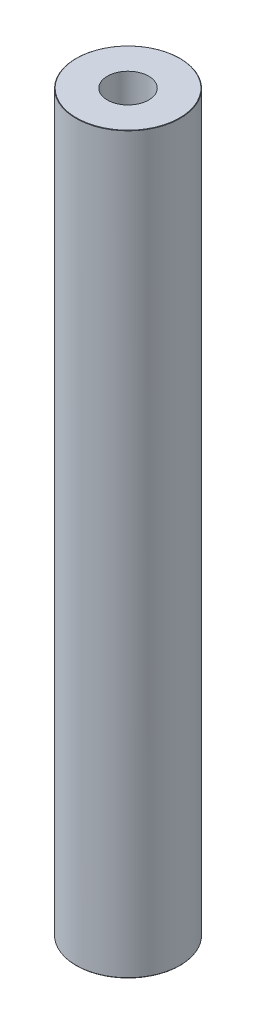
from build123d import *
from OCP.BRepFilletAPI import BRepFilletAPI_MakeChamfer

# Parameters (mm, degrees)
SKETCH1_R           = 42.5
BOSS_EXTRUDE1_DEPTH = 600
SKETCH2_R           = 16.905892699
CUT_EXTRUDE1_DEPTH  = 604.002902149
CHAMFER1_SIZE       = 0.224247194
CHAMFER1_SIZE2      = 0.339037478


with BuildPart() as part:
    # Sketch1 → Boss-Extrude1 (new body)
    with BuildSketch(Plane(origin=(0, 0, 0), x_dir=(1, 0, 0), z_dir=(0, 1, 0))):
        Circle(SKETCH1_R)
    extrude(amount=BOSS_EXTRUDE1_DEPTH)

    # Sketch2 → Cut-Extrude1 (cut, through all)
    with BuildSketch(Plane(origin=(0, 0, 0), x_dir=(1, 0, 0), z_dir=(0, 1, 0))):
        Circle(SKETCH2_R)
    extrude(amount=CUT_EXTRUDE1_DEPTH, mode=Mode.SUBTRACT)

    # Chamfer1: one chamfer whose edges measure the first distance from different faces: ONE call of the kernel's chamfer builder (chamfer() names one face for all edges)
    chamfer1_edges_1 = [part.edges().sort_by_distance(p)[0] for p in [
        (-42.5, 600, 0),
    ]]
    chamfer1_side_1 = [part.faces().sort_by_distance(p)[0] for p in [
        (-42.5, 300, 0),
    ]]
    chamfer1_edges_2 = [part.edges().sort_by_distance(p)[0] for p in [
        (-42.5, 0, 0),
    ]]
    chamfer1_side_2 = [part.faces().sort_by_distance(p)[0] for p in [
        (-41.297918472, 0, 0),
    ]]
    chamfer1 = BRepFilletAPI_MakeChamfer(part.part.solid().wrapped)
    for e in chamfer1_edges_1:
        chamfer1.Add(CHAMFER1_SIZE, CHAMFER1_SIZE2, e.wrapped, chamfer1_side_1[0].wrapped)  # the first distance lies on this face
    for e in chamfer1_edges_2:
        chamfer1.Add(CHAMFER1_SIZE, CHAMFER1_SIZE2, e.wrapped, chamfer1_side_2[0].wrapped)  # the first distance lies on this face
    add(Compound.cast(chamfer1.Shape()), mode=Mode.REPLACE)


solid = part.part
